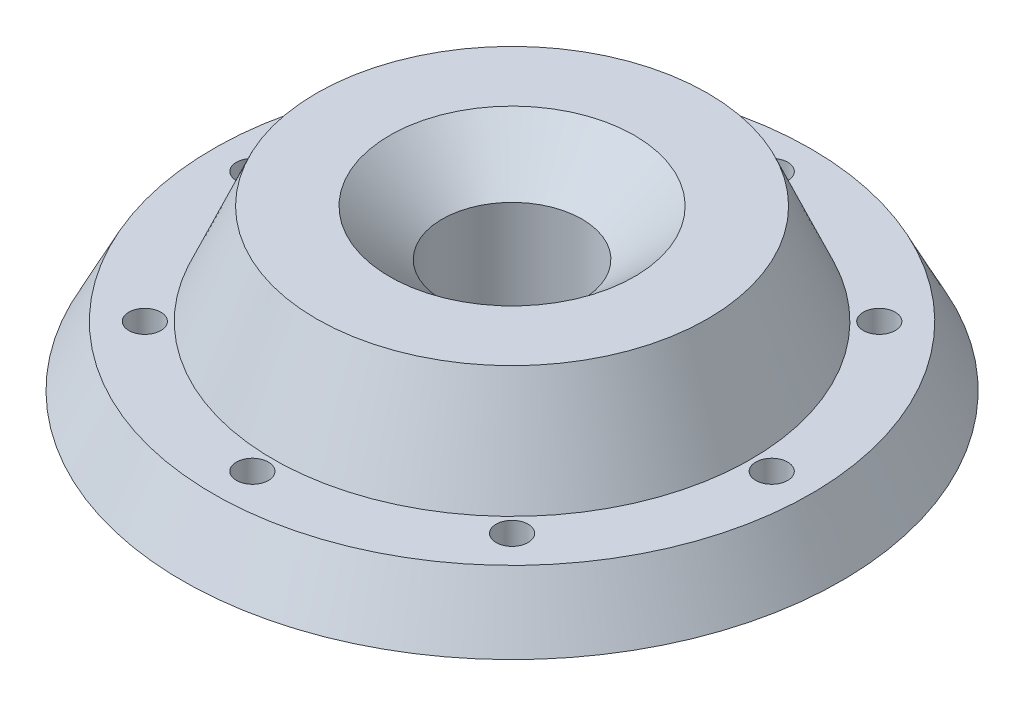
from build123d import *

# Parameters (mm, degrees)
SKETCH3_R          = 4
CUT_EXTRUDE2_DEPTH = 124.338963835


with BuildPart() as part:
    # Sketch2 → Revolve1 (revolve)
    with BuildSketch(Plane.XY):
        Polygon((82.5, 0), (56, 0), (53.859163496, 2.6), (17.5, 2.6), (17.5, 28.424345995), (30.642594744, 40), (48.948733943, 40), (59.800759634, 15), (74.825493348, 15), align=None)
    revolve(axis=Axis((0, 0, 0), (0, 1, 0)))

    # Sketch3 → Cut-Extrude2 (cut, through all)
    with BuildSketch(Plane.XZ):
        with Locations((65, 0)):
            Circle(SKETCH3_R)
        with Locations((45.961940777, -45.961940777)):
            Circle(SKETCH3_R)
        with Locations((0, -65)):
            Circle(SKETCH3_R)
        with Locations((-45.961940777, -45.961940777)):
            Circle(SKETCH3_R)
        with Locations((-65, 0)):
            Circle(SKETCH3_R)
        with Locations((-45.961940777, 45.961940777)):
            Circle(SKETCH3_R)
        with Locations((0, 65)):
            Circle(SKETCH3_R)
        with Locations((45.961940777, 45.961940777)):
            Circle(SKETCH3_R)
    extrude(amount=-CUT_EXTRUDE2_DEPTH, mode=Mode.SUBTRACT)


solid = part.part
